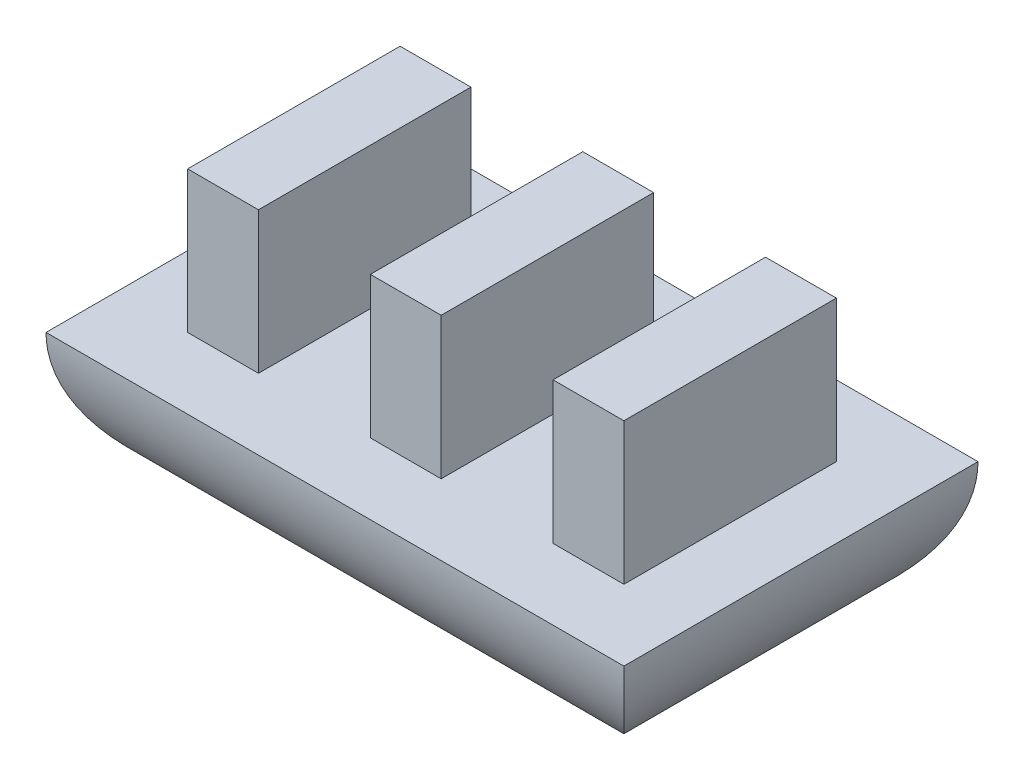
from build123d import *

# Parameters (mm, degrees)
SKETCH1_W           = 12.954
SKETCH1_H           = 7.9375
SKETCH1_W_2         = 1.5875
SKETCH1_H_2         = 4.7625
BOSS_EXTRUDE1_DEPTH = 3.175
SKETCH1_3_W         = 1.5875
SKETCH1_3_H         = 4.7625
BOSS_EXTRUDE2_DEPTH = 3.175
FILLET1_R           = 3.175


with BuildPart() as part:
    # Sketch1 → Boss-Extrude1 (new body)
    # profile 1 of 4: a face of its own
    with BuildSketch(Plane(origin=(0, 0, 0), x_dir=(1, 0, 0), z_dir=(0, 1, 0))):
        with Locations((6.477, 3.96875)):
            Rectangle(SKETCH1_W, SKETCH1_H)
        with Locations((10.57275, 3.96875)):
            Rectangle(SKETCH1_W_2, SKETCH1_H_2, mode=Mode.SUBTRACT)
        with Locations((6.477, 3.96875)):
            Rectangle(SKETCH1_W_2, SKETCH1_H_2, mode=Mode.SUBTRACT)
        with Locations((2.38125, 3.96875)):
            Rectangle(SKETCH1_W_2, SKETCH1_H_2, mode=Mode.SUBTRACT)
    # profile 2 of 4: a face of its own
    with BuildSketch(Plane(origin=(0, 0, 0), x_dir=(1, 0, 0), z_dir=(0, 1, 0))):
        with Locations((2.38125, 3.96875)):
            Rectangle(SKETCH1_W_2, SKETCH1_H_2)
    # profile 3 of 4: a face of its own
    with BuildSketch(Plane(origin=(0, 0, 0), x_dir=(1, 0, 0), z_dir=(0, 1, 0))):
        with Locations((6.477, 3.96875)):
            Rectangle(SKETCH1_W_2, SKETCH1_H_2)
    # profile 4 of 4: a face of its own
    with BuildSketch(Plane(origin=(0, 0, 0), x_dir=(1, 0, 0), z_dir=(0, 1, 0))):
        with Locations((10.57275, 3.96875)):
            Rectangle(SKETCH1_W_2, SKETCH1_H_2)
    extrude(amount=-BOSS_EXTRUDE1_DEPTH)

    # Sketch1<3> → Boss-Extrude2 (add)
    with BuildSketch(Plane(origin=(0, 0, 0), x_dir=(1, 0, 0), z_dir=(0, 1, 0))):
        with Locations((2.38125, 3.96875)):
            Rectangle(SKETCH1_3_W, SKETCH1_3_H)
        with Locations((6.477, 3.96875)):
            Rectangle(SKETCH1_3_W, SKETCH1_3_H)
        with Locations((10.57275, 3.96875)):
            Rectangle(SKETCH1_3_W, SKETCH1_3_H)
    extrude(amount=BOSS_EXTRUDE2_DEPTH)

    # Fillet1
    fillet1_edges = [part.edges().sort_by_distance(p)[0] for p in [
        (12.954, -3.175, -3.96875),
        (6.477, -3.175, -7.9375),
        (0, -3.175, -3.96875),
        (6.477, -3.175, 0),
    ]]
    fillet(fillet1_edges, radius=FILLET1_R - 0.0001)  # a hair under: the kernel refuses the full size


solid = part.part
